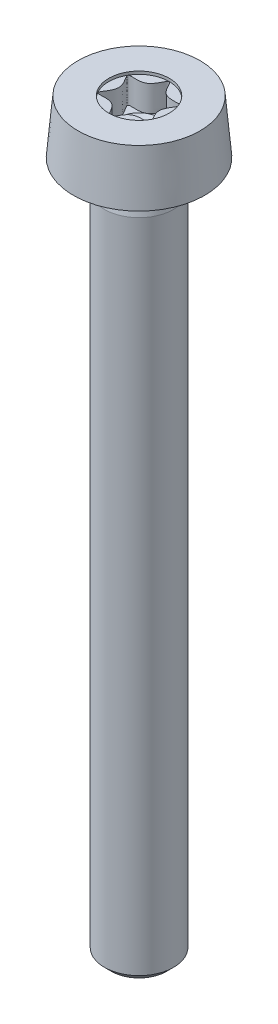
from build123d import *

# Parameters (mm, degrees)
FILLET1_R                 = 0.1
SOCKET_CUT_EXTRUDE1_DEPTH = 0.84
SKETCH3_R                 = 0.875
SOCKET_CUT_EXTRUDE2_DEPTH = 0.084
CHAFL_N1_SIZE             = 0.2


with BuildPart() as part:
    # Sketch1 → Body-Revolve (revolve)
    with BuildSketch(Plane.XY):
        Polygon((0, 21.55), (1.764392572, 21.55), (1.9, 20), (1, 20), (0.84, 20), (1, 19.2), (1, 0), (0, 0), align=None)
    revolve(axis=Axis((0, 0, 0), (0, 1, 0)))

    # Fillet1
    fillet1_edges = [part.edges().sort_by_distance(p)[0] for p in [
        (-0.84, 20, 0),
    ]]
    fillet(fillet1_edges, radius=FILLET1_R)

    # Sketch2 → Socket-Cut-Extrude1 (cut)
    with BuildSketch(Plane(origin=(0, 21.55, 0), x_dir=(-1, 0, 0), z_dir=(0, 1, 0))):
        with BuildLine():
            add(Edge.make_bspline(
                [(0, -0.875), (-0.062906837, -0.875), (-0.18872051, -0.326873512), (-0.99511796, -0.574531622), (-0.37744102, 0), (-0.99511796, 0.574531622), (-0.18872051, 0.326873512), (0, 1.149063244), (0.18872051, 0.326873512), (0.99511796, 0.574531622), (0.37744102, 0), (0.99511796, -0.574531622), (0.18872051, -0.326873512), (0.062906837, -0.875), (0, -0.875)],
                knots=[0, 0, 0, 0, 0.083333333, 0.166666667, 0.25, 0.333333333, 0.416666667, 0.5, 0.583333333, 0.666666667, 0.75, 0.833333333, 0.916666667, 1, 1, 1, 1], degree=3))
        make_face()
    extrude(amount=-SOCKET_CUT_EXTRUDE1_DEPTH, mode=Mode.SUBTRACT)

    # Sketch3 → Socket-Cut-Extrude2 (cut)
    with BuildSketch(Plane(origin=(0, 21.55, 0), x_dir=(-1, 0, 0), z_dir=(0, 1, 0))):
        Circle(SKETCH3_R)
    extrude(amount=-SOCKET_CUT_EXTRUDE2_DEPTH, mode=Mode.SUBTRACT)

    # Sketch4 → Drill-Cut-Revolve (revolve, cut)
    with BuildSketch(Plane.XY):
        Polygon((0, 20.71), (0.583333333, 20.71), (0, 20.155), align=None)
    revolve(axis=Axis((0, 0, 0), (0, 1, 0)), mode=Mode.SUBTRACT)

    # Chaflán1
    chafl_n1_edges = [part.edges().sort_by_distance(p)[0] for p in [
        (-1, 0, 0),
    ]]
    chamfer(chafl_n1_edges, length=CHAFL_N1_SIZE)


solid = part.part
